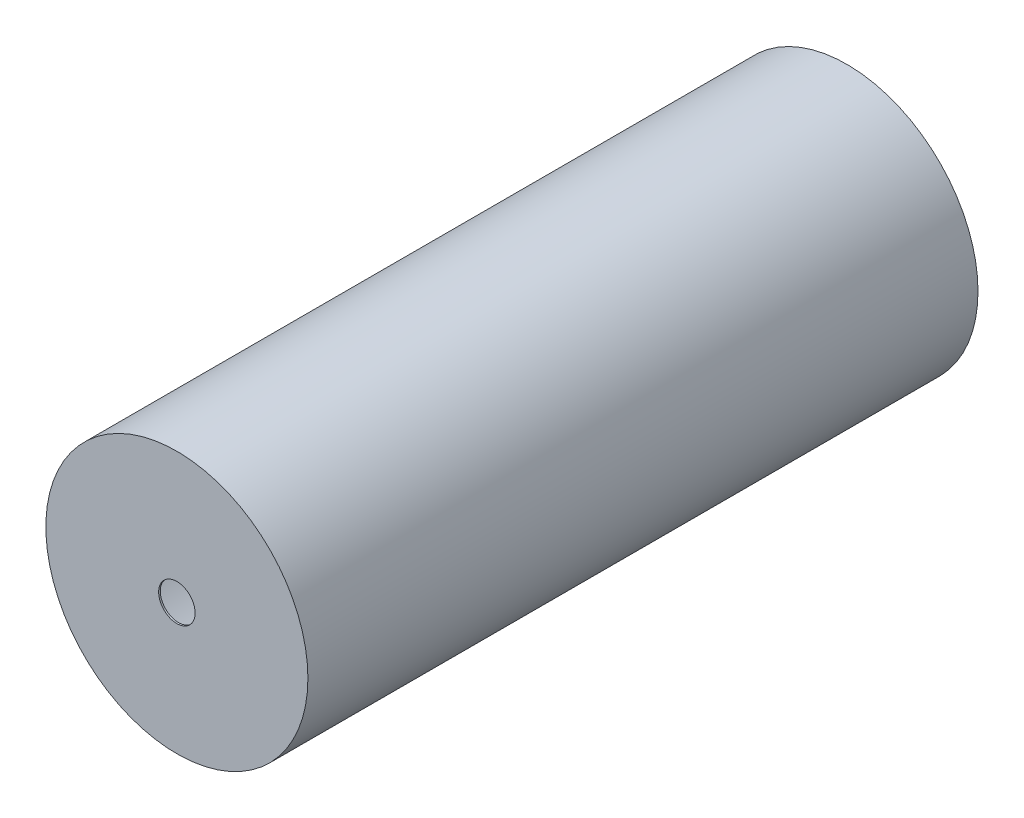
from build123d import *

# Parameters (mm, degrees)
SKETCH3_R          = 1.1
CUT_EXTRUDE1_DEPTH = 53


# Read off the part's stored shape, not the designer's step: Extrude-Thin1
with BuildPart() as part:
    # Extrude-Thin1 outline → Extrude-Thin1 (revolve)
    with BuildSketch(Plane.XZ):
        Polygon((7.9, 40.4), (0, 40.4), (0, 40.3), (7.8, 40.3), (7.8, 0.1), (0, 0.1), (0, 0), (7.9, 0), align=None)
    revolve(axis=Axis((0, 0, 0), (0, 0, 1)))

    # Sketch3 → Cut-Extrude1 (cut)
    with BuildSketch(Plane(origin=(0, 0, 0), x_dir=(-1, 0, 0), z_dir=(0, 0, -1))):
        Circle(SKETCH3_R)
    extrude(amount=-CUT_EXTRUDE1_DEPTH, mode=Mode.SUBTRACT)


solid = part.part
